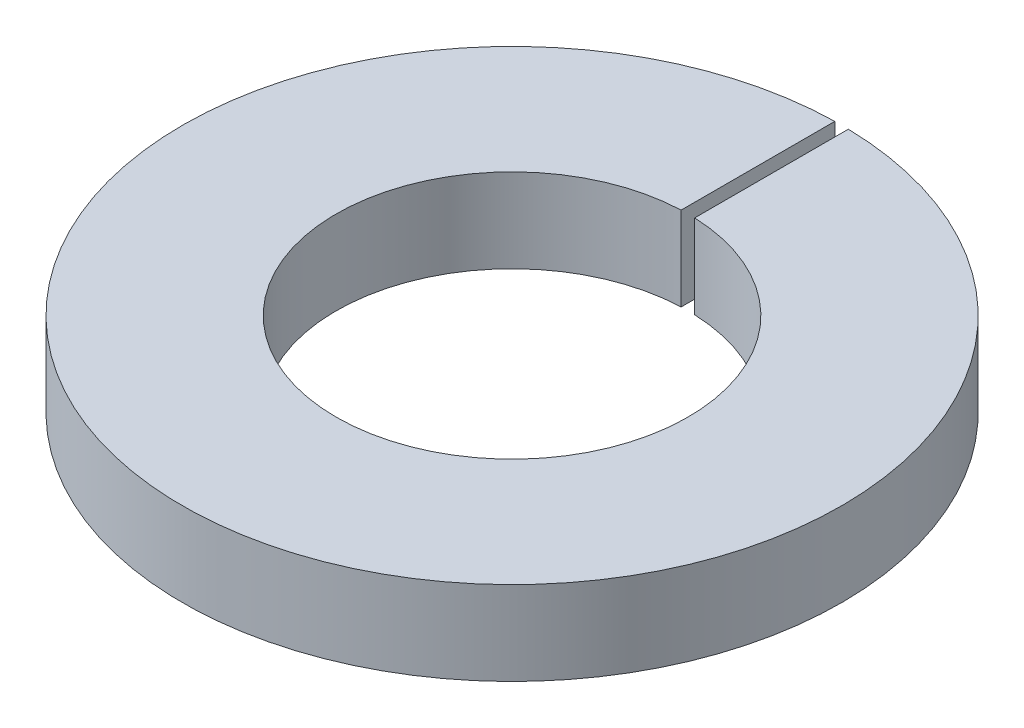
from build123d import *

# Parameters (mm, degrees)
BOSS_EXTRUDE1_DEPTH = 1.5748


with BuildPart() as part:
    # Sketch5 → Boss-Extrude1 (new body)
    with BuildSketch(Plane(origin=(0, 0, 0), x_dir=(1, 0, 0), z_dir=(0, 1, 0))):
        with BuildLine():
            Line((-0.127, 6.183595961), (-0.127, 3.299556788))
            ThreePointArc((-0.127, 3.299556788), (0, -3.302), (0.127, 3.299556788))
            Line((0.127, 3.299556788), (0.127, 6.183595961))
            ThreePointArc((0.127, 6.183595961), (0, -6.1849), (-0.127, 6.183595961))
        make_face()
    extrude(amount=BOSS_EXTRUDE1_DEPTH)


solid = part.part
